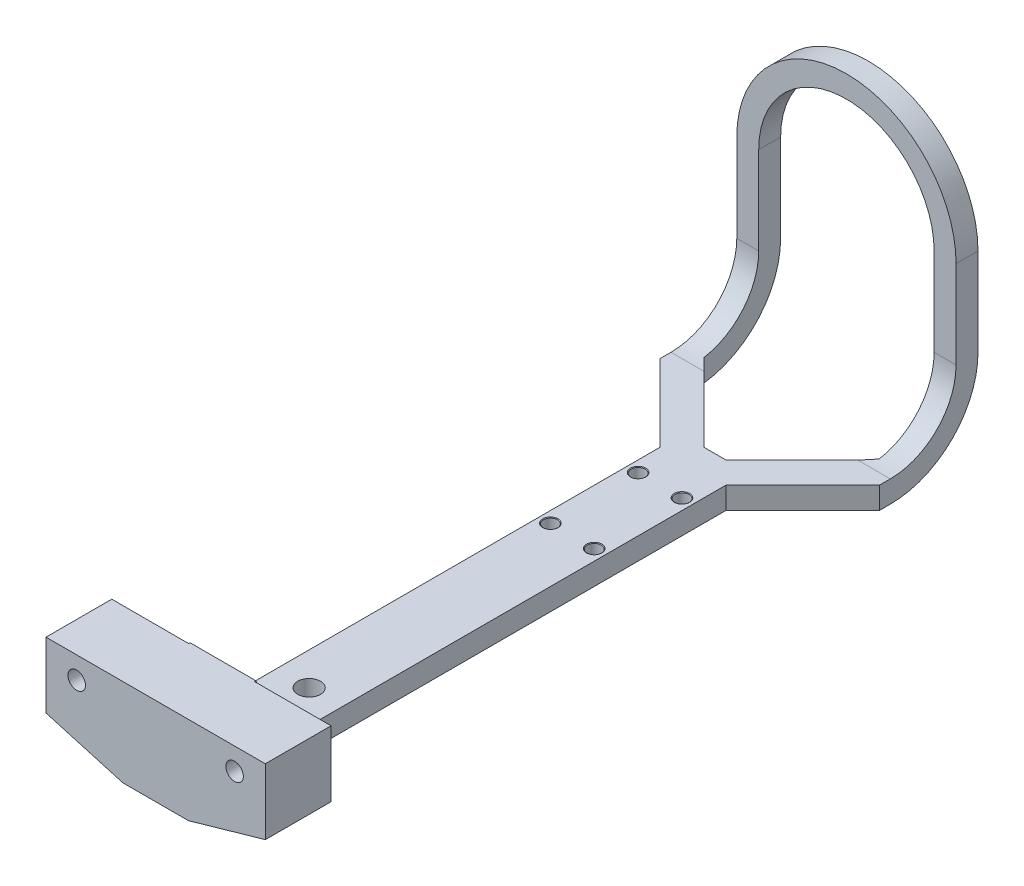
from build123d import *
from OCP.BRepFilletAPI import BRepFilletAPI_MakeChamfer

# Parameters (mm, degrees)
SKETCH1_W           = 15
SKETCH1_H           = 27.5
SKETCH1_W_2         = 10
SKETCH1_H_2         = 20
BOSS_EXTRUDE1_DEPTH = 5
SKETCH8_W           = 15
SKETCH8_H           = 90
BOSS_EXTRUDE2_DEPTH = 5
SKETCH9_R           = 2.6
CUT_EXTRUDE1_DEPTH  = 11
SKETCH11_W          = 50
SKETCH11_H          = 15
BOSS_EXTRUDE4_DEPTH = 15
CHAMFER1_SIZE       = 5
CHAMFER1_SIZE_2     = 17.437072219
CHAMFER2_SIZE       = 15.722257417
CHAMFER2_SIZE_2     = 7
SKETCH12_R          = 2
CUT_EXTRUDE2_DEPTH  = 122.783619588
SKETCH13_W          = 15
SKETCH13_H          = 10
BOSS_EXTRUDE5_DEPTH = 5
SKETCH15_W          = 5
SKETCH15_H          = 35
BOSS_EXTRUDE7_DEPTH = 5
BOSS_EXTRUDE8_DEPTH = 5
FILLET1_R           = 15
FILLET2_R           = 20
CHAMFER3_SIZE       = 17.5


# Read off the part's stored shape, not the designer's step: Ø3.0mm Dowel Hole1
# Some blends are built 0.0001 mm under size
with BuildPart() as part:
    # Sketch1 → Boss-Extrude1 (new body)
    # profile 1 of 2: a face of its own
    with BuildSketch(Plane(origin=(0, 0, 0), x_dir=(1, 0, 0), z_dir=(0, 1, 0))):
        with Locations((0, -1.25)):
            Rectangle(SKETCH1_W, SKETCH1_H)
        Rectangle(SKETCH1_W_2, SKETCH1_H_2, mode=Mode.SUBTRACT)
    # profile 2 of 2: a face of its own
    with BuildSketch(Plane(origin=(0, 0, 0), x_dir=(1, 0, 0), z_dir=(0, 1, 0))):
        Rectangle(SKETCH1_W_2, SKETCH1_H_2)
    extrude(amount=BOSS_EXTRUDE1_DEPTH)

    # Ø3.0mm Dowel Hole1 outline → Ø3.0mm Dowel Hole1 (revolve, cut)
    with BuildSketch(Plane(origin=(5, 0, -10), x_dir=(1, 0, 0), z_dir=(0, 0, 1))):
        Polygon((0, 0), (1.6, 0), (1.6, 4.874135055), (1.75, 5), (0, 5), align=None)
    revolve(axis=Axis((5, 0, -10), (0, 1, 0)), mode=Mode.SUBTRACT)

    # 3.0mm Dowel Hole1 2 outline → 3.0mm Dowel Hole1 2 (revolve, cut)
    with BuildSketch(Plane(origin=(-5, 0, 10), x_dir=(1, 0, 0), z_dir=(0, 0, 1))):
        Polygon((0, 0), (1.6, 0), (1.6, 4.874135055), (1.75, 5), (0, 5), align=None)
    revolve(axis=Axis((-5, 0, 10), (0, 1, 0)), mode=Mode.SUBTRACT)

    # 3.0mm Dowel Hole1 3 outline → 3.0mm Dowel Hole1 3 (revolve, cut)
    with BuildSketch(Plane(origin=(-5, 0, -10), x_dir=(1, 0, 0), z_dir=(0, 0, 1))):
        Polygon((0, 0), (1.6, 0), (1.6, 4.874135055), (1.75, 5), (0, 5), align=None)
    revolve(axis=Axis((-5, 0, -10), (0, 1, 0)), mode=Mode.SUBTRACT)

    # 3.0mm Dowel Hole1 4 outline → 3.0mm Dowel Hole1 4 (revolve, cut)
    with BuildSketch(Plane(origin=(5, 0, 10), x_dir=(1, 0, 0), z_dir=(0, 0, 1))):
        Polygon((0, 0), (1.6, 0), (1.6, 4.874135055), (1.75, 5), (0, 5), align=None)
    revolve(axis=Axis((5, 0, 10), (0, 1, 0)), mode=Mode.SUBTRACT)

    # Sketch8 → Boss-Extrude2 (add)
    with BuildSketch(Plane(origin=(0, 5, 0), x_dir=(1, 0, 0), z_dir=(0, 1, 0))):
        with Locations((0, -60)):
            Rectangle(SKETCH8_W, SKETCH8_H)
    extrude(amount=-BOSS_EXTRUDE2_DEPTH)

    # Sketch9 → Cut-Extrude1 (cut)
    with BuildSketch(Plane(origin=(0, 0, 0), x_dir=(1, 0, 0), z_dir=(0, 1, 0))):
        with Locations(Location((0, -70, 0), (0, 0, 270))):
            Circle(SKETCH9_R)
    extrude(amount=CUT_EXTRUDE1_DEPTH, mode=Mode.SUBTRACT)

    # Sketch11 → Boss-Extrude4 (add)
    with BuildSketch(Plane(origin=(0, 5, 0), x_dir=(1, 0, 0), z_dir=(0, 1, 0))):
        with Locations((0, -97.5)):
            Rectangle(SKETCH11_W, SKETCH11_H)
    extrude(amount=BOSS_EXTRUDE4_DEPTH)

    # Chamfer1
    chamfer1_edges_1 = [part.edges().sort_by_distance(p)[0] for p in [
        (7.5, 5, 97.5),
    ]]
    chamfer1_side_1 = [part.faces().sort_by_distance(p)[0] for p in [
        (7.5, 4.9, 97.5),
    ]]
    chamfer1_edges_2 = [part.edges().sort_by_distance(p)[0] for p in [
        (-7.5, 5, 97.5),
    ]]
    chamfer1_side_2 = [part.faces().sort_by_distance(p)[0] for p in [
        (-7.5, 4.9, 97.5),
    ]]
    chamfer1 = BRepFilletAPI_MakeChamfer(part.part.solid().wrapped)
    for e in chamfer1_edges_1:
        chamfer1.Add(CHAMFER1_SIZE - 0.0001, CHAMFER1_SIZE_2 - 0.0001, e.wrapped, chamfer1_side_1[0].wrapped)
    for e in chamfer1_edges_2:
        chamfer1.Add(CHAMFER1_SIZE - 0.0001, CHAMFER1_SIZE_2 - 0.0001, e.wrapped, chamfer1_side_2[0].wrapped)
    add(Compound.cast(chamfer1.Shape()), mode=Mode.REPLACE)  # a hair under: the kernel refuses the full size

    # Chamfer2
    # the kernel refuses this chamfer: 15.722257417, 7 mm, written as the material it adds along each edge
    with BuildSketch(Plane(origin=(-7.5, 5, 90), x_dir=(0, 0.9998768419809391, 0.015693975602887097), z_dir=(1, 0, 0))) as chamfer2_piece_1_section:
        Polygon((CHAMFER2_SIZE * 0.999876842002, -CHAMFER2_SIZE * 0.0156939756032), (-CHAMFER2_SIZE_2 * 0.0156939756029, -CHAMFER2_SIZE_2 * 0.999876841981), (0, 0), align=None)
    chamfer2_piece_1 = extrude(amount=15, mode=Mode.PRIVATE)
    chamfer2_piece_1 = split(chamfer2_piece_1, bisect_by=Plane(origin=(0, 20, 87.661958793), z_dir=(0, -1, 0)), keep=Keep.TOP, mode=Mode.PRIVATE)
    add(chamfer2_piece_1)

    # Sketch12 → Cut-Extrude2 (cut, through all)
    with BuildSketch(Plane.XY.offset(105)):
        with Locations((-18, 15)):
            Circle(SKETCH12_R)
        with Locations((18, 15)):
            Circle(SKETCH12_R)
    extrude(amount=-CUT_EXTRUDE2_DEPTH, mode=Mode.SUBTRACT)

    # Sketch13 → Boss-Extrude5 (add)
    with BuildSketch(Plane(origin=(0, 5, 0), x_dir=(1, 0, 0), z_dir=(0, 1, 0))):
        with Locations((0, 17.5)):
            Rectangle(SKETCH13_W, SKETCH13_H)
    extrude(amount=-BOSS_EXTRUDE5_DEPTH)

    # Sketch15 → Boss-Extrude7 (add)
    with BuildSketch(Plane(origin=(0, 5, 0), x_dir=(1, 0, 0), z_dir=(0, 1, 0))):
        with Locations((-22.5, 40)):
            Rectangle(SKETCH15_W, SKETCH15_H)
        Polygon((-7.5, 17.5), (-7.5, 22.5), (-20, 22.5), (-25, 22.5), (-25, 17.5), align=None)
        Polygon((25, 17.5), (25, 22.5), (20, 22.5), (7.5, 22.5), (7.5, 17.5), align=None)
        with Locations((22.5, 40)):
            Rectangle(SKETCH15_W, SKETCH15_H)
    extrude(amount=-BOSS_EXTRUDE7_DEPTH)

    # Sketch16 → Boss-Extrude8 (add)
    with BuildSketch(Plane(origin=(0, 0, -57.5), x_dir=(-1, 0, 0), z_dir=(0, 0, -1))):
        with BuildLine():
            Line((-20, 40), (-25, 40))
            ThreePointArc((-25, 40), (-23.717082451, 32.09430585), (-20, 25))
            Line((-20, 25), (-20, 40))
        make_face()
        with BuildLine():
            Line((20, 40), (25, 40))
            ThreePointArc((25, 40), (0, 65), (-25, 40))
            Line((-25, 40), (-20, 40))
            ThreePointArc((-20, 40), (0, 60), (20, 40))
        make_face()
        with BuildLine():
            ThreePointArc((20, 25), (23.717082451, 32.09430585), (25, 40))
            Line((25, 40), (20, 40))
            Line((20, 40), (20, 25))
        make_face()
        with BuildLine():
            Line((20, 5), (25, 5))
            Line((25, 5), (25, 40))
            ThreePointArc((25, 40), (23.717082451, 32.09430585), (20, 25))
            Line((20, 25), (20, 5))
        make_face()
        with BuildLine():
            ThreePointArc((-20, 25), (-23.717082451, 32.09430585), (-25, 40))
            Line((-25, 40), (-25, 0))
            Line((-25, 0), (-20, 0))
            Line((-20, 0), (-20, 25))
        make_face()
    extrude(amount=-BOSS_EXTRUDE8_DEPTH)

    # Fillet1
    fillet1_edges = [part.edges().sort_by_distance(p)[0] for p in [
        (-22.5, 5, -52.5),
        (22.5, 5, -52.5),
    ]]
    fillet(fillet1_edges, radius=FILLET1_R)

    # Fillet2
    fillet2_edges = [part.edges().sort_by_distance(p)[0] for p in [
        (-22.5, 0, -57.5),
        (22.5, 0, -57.5),
    ]]
    fillet(fillet2_edges, radius=FILLET2_R)

    # Chamfer3
    chamfer3_edges = [part.edges().sort_by_distance(p)[0] for p in [
        (-25, 2.5, -17.5),
        (-20, 2.5, -22.5),
        (25, 2.5, -17.5),
        (20, 2.5, -22.5),
    ]]
    chamfer(chamfer3_edges, length=CHAMFER3_SIZE - 0.0001)  # a hair under: the kernel refuses the full size


solid = part.part
